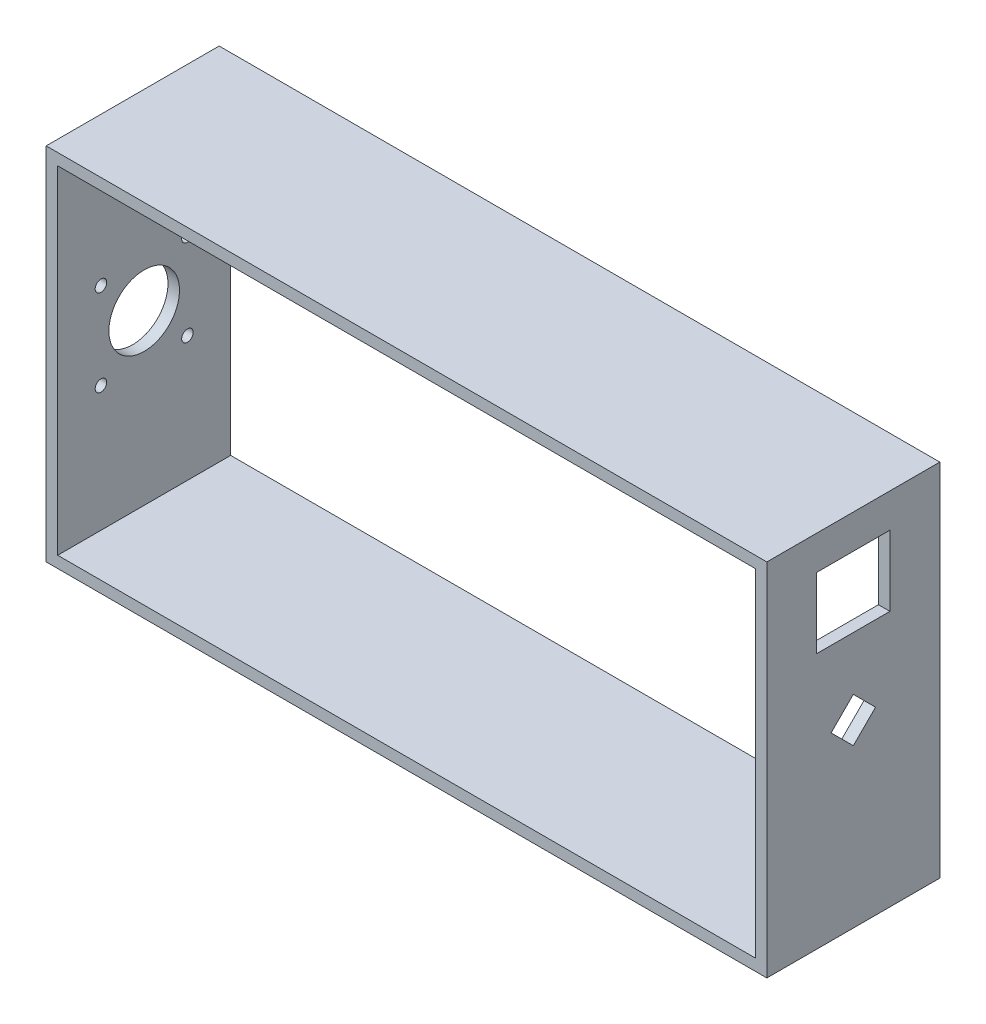
from build123d import *

# Parameters (mm, degrees)
SKIZZE1_W                       = 250
SKIZZE1_H                       = 125
SKIZZE1_W_2                     = 242
SKIZZE1_H_2                     = 117
AUFSATZ_LINEAR_AUSTRAGEN1_DEPTH = 60
SKIZZE2_R                       = 12.25
SKIZZE2_R_2                     = 2
SCHNITT_LINEAR_AUSTRAGEN1_DEPTH = 10
SKIZZE8_W                       = 25.4
SKIZZE8_H                       = 24.4
SCHNITT_LINEAR_AUSTRAGEN6_DEPTH = 22


with BuildPart() as part:
    # Skizze1 → Aufsatz-Linear austragen1 (new body)
    with BuildSketch(Plane.XY):
        with Locations((125, 62.5)):
            Rectangle(SKIZZE1_W, SKIZZE1_H)
        with Locations((125, 62.5)):
            Rectangle(SKIZZE1_W_2, SKIZZE1_H_2, mode=Mode.SUBTRACT)
    extrude(amount=AUFSATZ_LINEAR_AUSTRAGEN1_DEPTH)

    # Skizze2 → Schnitt-Linear austragen1 (cut)
    with BuildSketch(Plane.ZY):
        with Locations((30, 62.5)):
            Circle(SKIZZE2_R)
        with Locations((15, 77.5)):
            Circle(SKIZZE2_R_2)
        with Locations((45, 77.5)):
            Circle(SKIZZE2_R_2)
        with Locations((45, 47.5)):
            Circle(SKIZZE2_R_2)
        with Locations((15, 47.5)):
            Circle(SKIZZE2_R_2)
    extrude(amount=-SCHNITT_LINEAR_AUSTRAGEN1_DEPTH, mode=Mode.SUBTRACT)

    # Skizze8 → Schnitt-Linear austragen6 (cut)
    with BuildSketch(Plane(origin=(250, 0, 0), x_dir=(0, 0, -1), z_dir=(1, 0, 0))):
        Polygon((-30, 70.207463915), (-37.707463915, 62.5), (-30, 54.792536085), (-22.292536085, 62.5), align=None)
        with Locations((-30, 101)):
            Rectangle(SKIZZE8_W, SKIZZE8_H)
    extrude(amount=-SCHNITT_LINEAR_AUSTRAGEN6_DEPTH, mode=Mode.SUBTRACT)


solid = part.part
